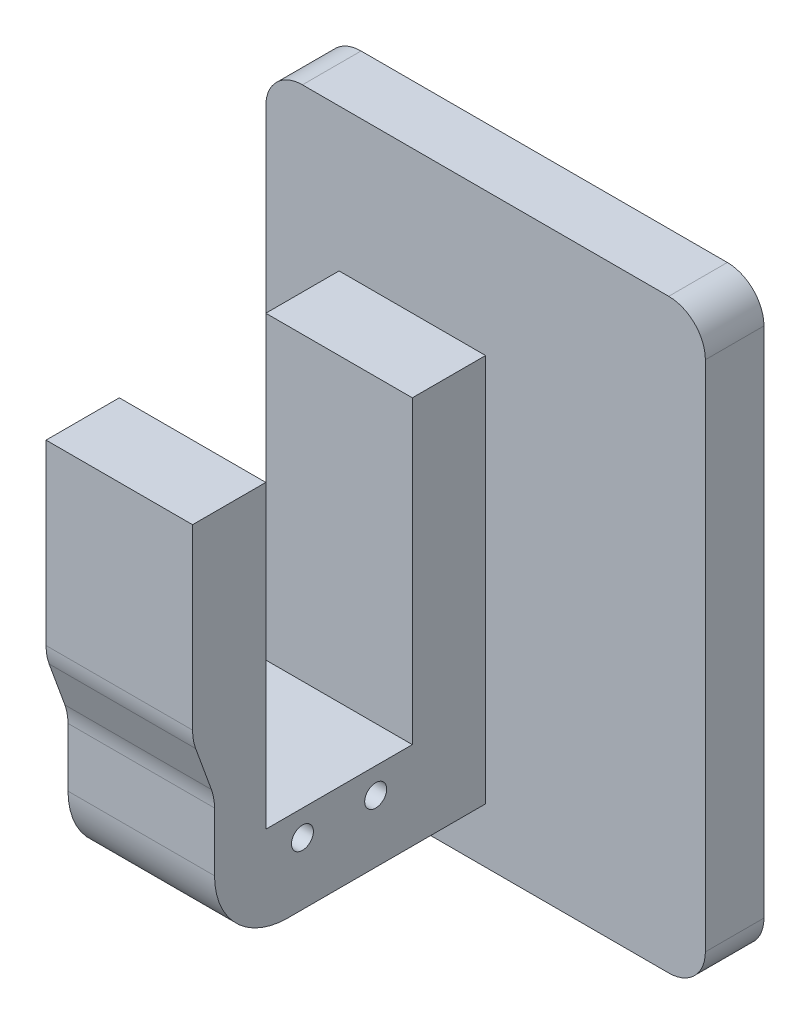
from build123d import *

# Parameters (mm, degrees)
BOSS_EXTRUDE1_DEPTH = 8
CUT_EXTRUDE3_DEPTH  = 3
BOSS_EXTRUDE4_START = 9
SKETCH10_R          = 9.75
BOSS_EXTRUDE4_DEPTH = 9
BOSS_EXTRUDE5_DEPTH = 20
SKETCH13_R          = 1.5
CUT_EXTRUDE4_DEPTH  = 10
SKETCH14_R          = 12
BOSS_EXTRUDE6_DEPTH = 1
FILLET4_R           = 10
FILLET5_R           = 7


with BuildPart() as part:
    # Sketch3 → Boss-Extrude1 (new body)
    with BuildSketch(Plane(origin=(0, 0, 30), x_dir=(-1, 0, 0), z_dir=(0, 0, -1))):
        with BuildLine():
            Line((55, 53.257283518), (105, 53.257283518))
            ThreePointArc((105, 53.257283518), (108.535533906, 51.792817424), (110, 48.257283518))
            Line((110, 48.257283518), (110, -21.742716482))
            ThreePointArc((110, -21.742716482), (108.535533906, -25.278250388), (105, -26.742716482))
            Line((105, -26.742716482), (55, -26.742716482))
            ThreePointArc((55, -26.742716482), (51.464466094, -25.278250388), (50, -21.742716482))
            Line((50, -21.742716482), (50, 48.257283518))
            ThreePointArc((50, 48.257283518), (51.464466094, 51.792817424), (55, 53.257283518))
        make_face()
    extrude(amount=BOSS_EXTRUDE1_DEPTH)

    # Sketch8 → Cut-Extrude3 (cut)
    with BuildSketch(Plane(origin=(0, 0, 22), x_dir=(-1, 0, 0), z_dir=(0, 0, -1))):
        with BuildLine():
            Line((78.25, 15.378603862), (78.25, 11.135963175))
            ThreePointArc((78.25, 11.135963175), (80, 10.507283518), (81.75, 11.135963175))
            Line((81.75, 11.135963175), (81.75, 15.378603862))
            ThreePointArc((81.75, 15.378603862), (80, 16.007283518), (78.25, 15.378603862))
        make_face()
    extrude(amount=-CUT_EXTRUDE3_DEPTH, mode=Mode.SUBTRACT)

    # Sketch10 → Boss-Extrude4 (add)
    with BuildSketch(Plane(origin=(0, 0, 22), x_dir=(-1, 0, 0), z_dir=(0, 0, -1)).offset(BOSS_EXTRUDE4_START)):
        with Locations((80, 13.257283518)):
            Circle(SKETCH10_R)
        with BuildLine():
            Line((81.75, 11.135963175), (81.75, 15.378603862))
            ThreePointArc((81.75, 15.378603862), (80, 16.007283518), (78.25, 15.378603862))
            Line((78.25, 15.378603862), (78.25, 11.135963175))
            ThreePointArc((78.25, 11.135963175), (80, 10.507283518), (81.75, 11.135963175))
        make_face(mode=Mode.SUBTRACT)
    extrude(amount=-BOSS_EXTRUDE4_DEPTH)

    # Sketch12 → Boss-Extrude5 (add)
    with BuildSketch(Plane.ZY.offset(80)):
        Polygon((30, -19.242716482), (30, 33.757283518), (40, 33.757283518), (40, -7.242716482), (60, -7.242716482), (60, 33.757283518), (70, 33.757283518), (70, 8.239359157), (67.001118517, 0), (67.001118517, -19.242716482), align=None)
    extrude(amount=BOSS_EXTRUDE5_DEPTH)

    # Sketch13 → Cut-Extrude4 (cut)
    with BuildSketch(Plane(origin=(-80, 0, 0), x_dir=(0, 0, -1), z_dir=(1, 0, 0))):
        with Locations((-55, -10.742716482)):
            Circle(SKETCH13_R)
        with Locations((-45, -10.742716482)):
            Circle(SKETCH13_R)
        with Locations((-55, 37.257283518)):
            Circle(SKETCH13_R)
        with Locations((-45, 37.257283518)):
            Circle(SKETCH13_R)
    extrude(amount=-CUT_EXTRUDE4_DEPTH, mode=Mode.SUBTRACT)

    # Sketch14 → Boss-Extrude6 (add)
    with BuildSketch(Plane(origin=(0, 0, 22), x_dir=(-1, 0, 0), z_dir=(0, 0, -1))):
        with Locations((80, 13.257283518)):
            Circle(SKETCH14_R)
    extrude(amount=BOSS_EXTRUDE6_DEPTH)

    # Fillet4
    fillet4_edges = [part.edges().sort_by_distance(p)[0] for p in [
        (-90, -19.242716482, 67.001118517),
    ]]
    fillet(fillet4_edges, radius=FILLET4_R)

    # Fillet5
    fillet5_edges = [part.edges().sort_by_distance(p)[0] for p in [
        (-90, 8.239359157, 70),
        (-90, 0, 67.001118517),
    ]]
    fillet(fillet5_edges, radius=FILLET5_R)


solid = part.part
